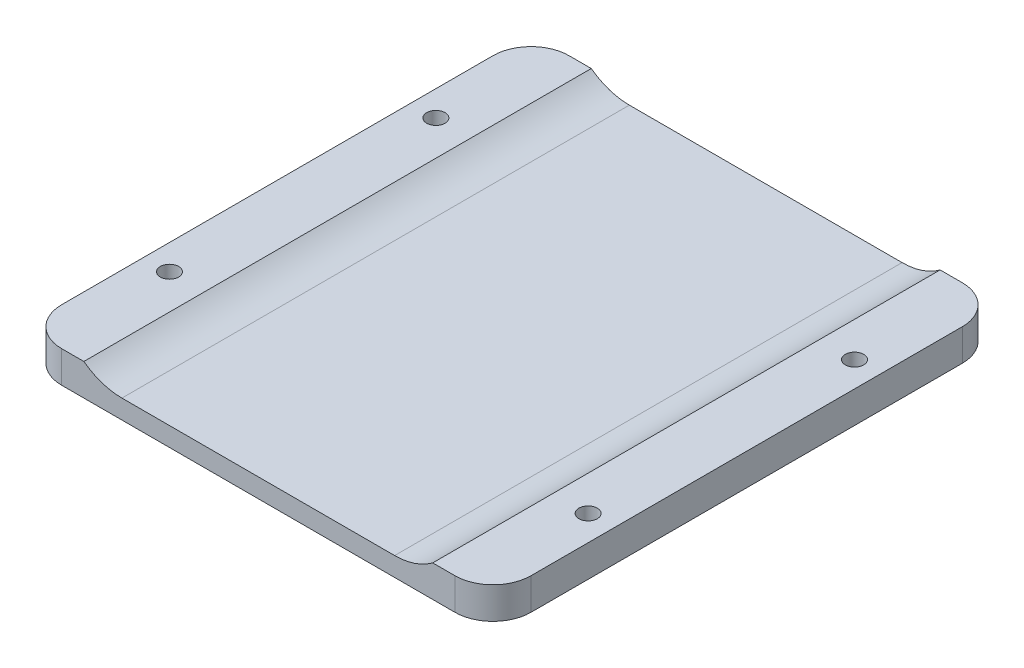
from build123d import *

# Parameters (mm, degrees)
SKETCH_1_W          = 74
SKETCH_1_H          = 80
SKETCH_1_R          = 1.45
EXTRUDE_1_DEPTH     = 5
FILLET_1_R          = 6
SKETCH_2_W          = 55
SKETCH_2_H          = 80
CUT_EXTRUDE_1_DEPTH = 2
FILLET_2_R          = 10


with BuildPart() as part:
    # 草图1 → 凸台-拉伸1 (new body)
    with BuildSketch(Plane(origin=(0, 0, 0), x_dir=(1, 0, 0), z_dir=(0, 1, 0))):
        Rectangle(SKETCH_1_W, SKETCH_1_H)
        with Locations(Location((-33, 21, 0), (0, 0, 270))):
            Circle(SKETCH_1_R, mode=Mode.SUBTRACT)
        with Locations(Location((-33, -21, 0), (0, 0, 90))):
            Circle(SKETCH_1_R, mode=Mode.SUBTRACT)
        with Locations(Location((33, -21, 0), (0, 0, 270))):
            Circle(SKETCH_1_R, mode=Mode.SUBTRACT)
        with Locations(Location((33, 21, 0), (0, 0, 90))):
            Circle(SKETCH_1_R, mode=Mode.SUBTRACT)
    extrude(amount=EXTRUDE_1_DEPTH)

    # 圆角1
    fillet_1_edges = [part.edges().sort_by_distance(p)[0] for p in [
        (37, 2.5, 40),
        (-37, 2.5, 40),
        (-37, 2.5, -40),
        (37, 2.5, -40),
    ]]
    fillet(fillet_1_edges, radius=FILLET_1_R)

    # 草图2 → 切除-拉伸1 (cut)
    with BuildSketch(Plane(origin=(0, 5, 0), x_dir=(1, 0, 0), z_dir=(0, 1, 0))):
        Rectangle(SKETCH_2_W, SKETCH_2_H)
    extrude(amount=-CUT_EXTRUDE_1_DEPTH, mode=Mode.SUBTRACT)

    # 圆角2
    # the kernel refuses this fillet: 10 mm, written as the material it adds along each edge
    with BuildSketch(Plane(origin=(-27.5, 3, -40), x_dir=(1, 0, 0), z_dir=(0, 0, 1))) as fillet_2_piece_1:
        with BuildLine():
            CenterArc((6, 10), FILLET_2_R, 233.130102354, 36.869897646)
            Line((0, 2), (-0.12, 1.84))
            ThreePointArc((-0.12, 1.84), (-0.2, 1), (-0.2, 0))
            Line((-0.2, 0), (0, -0.2))
            Line((0, -0.2), (6, -0.2))
            Line((6, -0.2), (6, 0))
        make_face()
    extrude(amount=80)
    with BuildSketch(Plane(origin=(27.5, 3, 40), x_dir=(0, 1, 0), z_dir=(0, 0, -1))) as fillet_2_piece_2:
        with BuildLine():
            CenterArc((10, -6), FILLET_2_R, 143.130102354, 36.869897646)
            Line((0, -6), (-0.2, -6))
            Line((-0.2, -6), (-0.2, 0))
            Line((-0.2, 0), (0, 0.2))
            ThreePointArc((0, 0.2), (1, 0.2), (1.84, 0.12))
            Line((1.84, 0.12), (2, 0))
        make_face()
    extrude(amount=80)


solid = part.part
